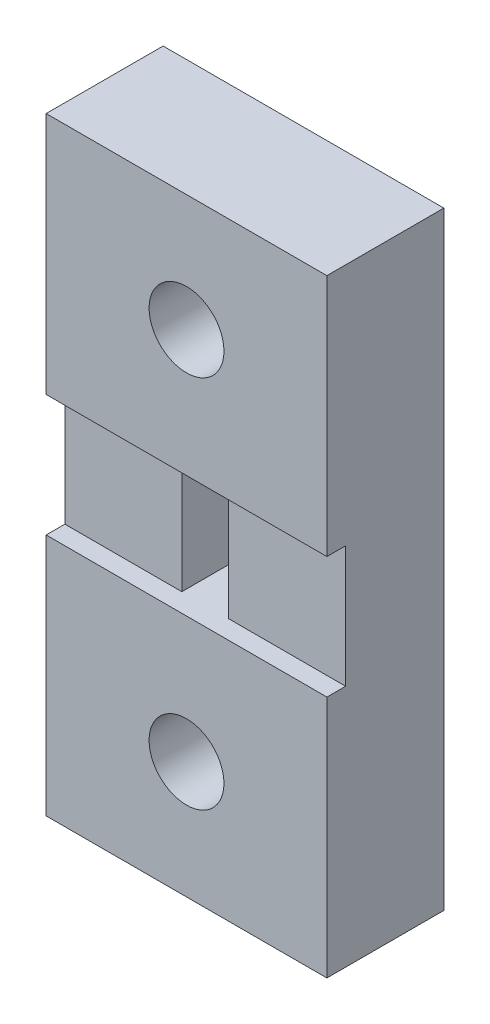
from build123d import *

# Parameters (mm, degrees)
SKETCH1_W           = 12
SKETCH1_H           = 26
BOSS_EXTRUDE1_DEPTH = 5
SKETCH3_W           = 12
SKETCH3_H           = 5.2
CUT_EXTRUDE1_DEPTH  = 0.8
CUT_EXTRUDE2_DEPTH  = 2.5


with BuildPart() as part:
    # Sketch1 → Boss-Extrude1 (new body)
    with BuildSketch(Plane.XY):
        Rectangle(SKETCH1_W, SKETCH1_H)
        with BuildLine():
            ThreePointArc((1.6, -8), (-1.13137085, -9.13137085), (0, -6.4))
            ThreePointArc((0, -6.4), (1.13137085, -6.86862915), (1.6, -8))
        make_face(mode=Mode.SUBTRACT)
        Polygon((1, -2.6), (0, -2.6), (-1, -2.6), (-1, 2.6), (0, 2.6), (1, 2.6), align=None, mode=Mode.SUBTRACT)
        with BuildLine():
            ThreePointArc((1.6, 8), (1.13137085, 6.86862915), (0, 6.4))
            ThreePointArc((0, 6.4), (-1.13137085, 9.13137085), (1.6, 8))
        make_face(mode=Mode.SUBTRACT)
    extrude(amount=BOSS_EXTRUDE1_DEPTH)

    # Sketch3 → Cut-Extrude1 (cut)
    with BuildSketch(Plane.XY.offset(5)):
        Rectangle(SKETCH3_W, SKETCH3_H)
    extrude(amount=-CUT_EXTRUDE1_DEPTH, mode=Mode.SUBTRACT)

    # Sketch4 → Cut-Extrude2 (cut)
    with BuildSketch(Plane(origin=(0, 0, 0), x_dir=(-1, 0, 0), z_dir=(0, 0, -1))):
        Polygon((1.732050808, 11), (-1.732050808, 11), (-3.464101615, 8), (-1.732050808, 5), (1.732050808, 5), (3.464101615, 8), align=None)
        Polygon((1.732050808, -5), (-1.732050808, -5), (-3.464101615, -8), (-1.732050808, -11), (1.732050808, -11), (3.464101615, -8), align=None)
    extrude(amount=-CUT_EXTRUDE2_DEPTH, mode=Mode.SUBTRACT)


solid = part.part
